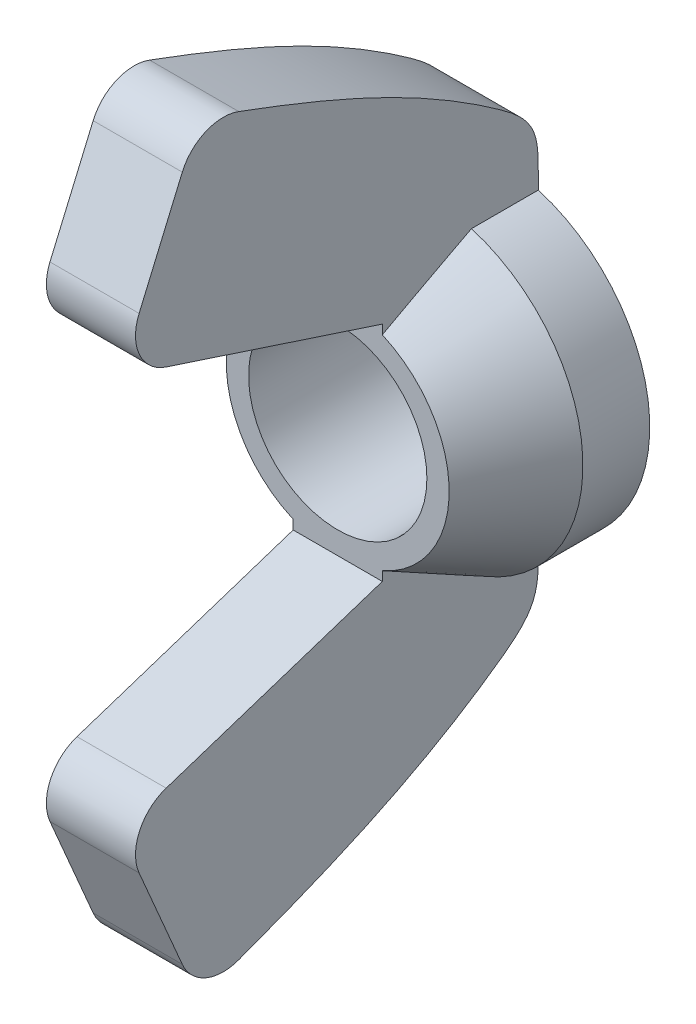
from build123d import *

# Parameters (mm, degrees)
SKETCH1_R      = 5.55625
SKETCH1_R_2    = 3.175
EXTRUDE1_DEPTH = 5.55625
CHAMFER2_SIZE  = 3.175
CHAMFER2_SIZE2 = 1.5875
EXTRUDE2_START = -1.5875
EXTRUDE2_DEPTH = 3.175
FILLET1_R      = 1.5875


# Read off the part's stored shape, not the designer's step: Extrude2
with BuildPart() as part:
    # Sketch1 → Extrude1 (new body)
    with BuildSketch(Plane.XY):
        Circle(SKETCH1_R)
        Circle(SKETCH1_R_2, mode=Mode.SUBTRACT)
    extrude(amount=EXTRUDE1_DEPTH)

    # Chamfer2
    chamfer2_edges = [part.edges().sort_by_distance(p)[0] for p in [
        (-5.55625, 0, 5.55625),
    ]]
    chamfer2_side = [part.faces().sort_by_distance(p)[0] for p in [
        (-5.55625, 0, 2.778125),
    ]]
    chamfer(chamfer2_edges, length=CHAMFER2_SIZE, length2=CHAMFER2_SIZE2, reference=chamfer2_side[0])

    # Extrude2 outline → Extrude2 (add)
    with BuildSketch(Plane(origin=(0, 0, 0), x_dir=(0, 0, -1), z_dir=(1, 0, 0)).offset(EXTRUDE2_START)):
        with BuildLine():
            add(Edge.make_bspline(
                [(0, 5.55625), (0, 6.123228392), (0.06889711, 7.408271372), (-4.266214485, 10.742230895), (-8.454781371, 12.27379248), (-12.086719505, 13.601821154)],
                knots=[0, 0, 0, 0, 0.111227896, 0.229338963, 1, 1, 1, 1], degree=3))
            Line((-12.086719505, 13.601821154), (-14.900780495, 7.035678846))
            Line((-14.900780495, 7.035678846), (-5.55625, 3.96875))
            Line((-5.55625, 3.96875), (-5.55625, 3.400788734))
            Line((-5.55625, 3.400788734), (-2.261327467, 5.04825))
            Line((-2.261327467, 5.04825), (0, 5.04825))
            Line((0, 5.04825), (0, 5.55625))
        make_face()
        with BuildLine():
            Line((-5.55625, -3.96875), (-14.900780495, -7.035678846))
            Line((-14.900780495, -7.035678846), (-12.086719505, -13.601821154))
            add(Edge.make_bspline(
                [(-12.086719505, -13.601821154), (-8.454781371, -12.27379248), (-4.266214485, -10.742230895), (0.06889711, -7.408271372), (0, -6.123228392), (0, -5.55625)],
                knots=[0, 0, 0, 0, 0.770661037, 0.888772104, 1, 1, 1, 1], degree=3))
            Line((0, -5.55625), (0, -5.04825))
            Line((0, -5.04825), (-2.261327467, -5.04825))
            Line((-2.261327467, -5.04825), (-5.55625, -3.400788734))
            Line((-5.55625, -3.400788734), (-5.55625, -3.96875))
        make_face()
    extrude(amount=EXTRUDE2_DEPTH)

    # Fillet1
    fillet1_edges = [part.edges().sort_by_distance(p)[0] for p in [
        (0, 13.601821154, 12.086719505),
        (0, 7.035678846, 14.900780495),
        (0, -7.035678846, 14.900780495),
        (0, -13.601821154, 12.086719505),
    ]]
    fillet(fillet1_edges, radius=FILLET1_R)


solid = part.part
